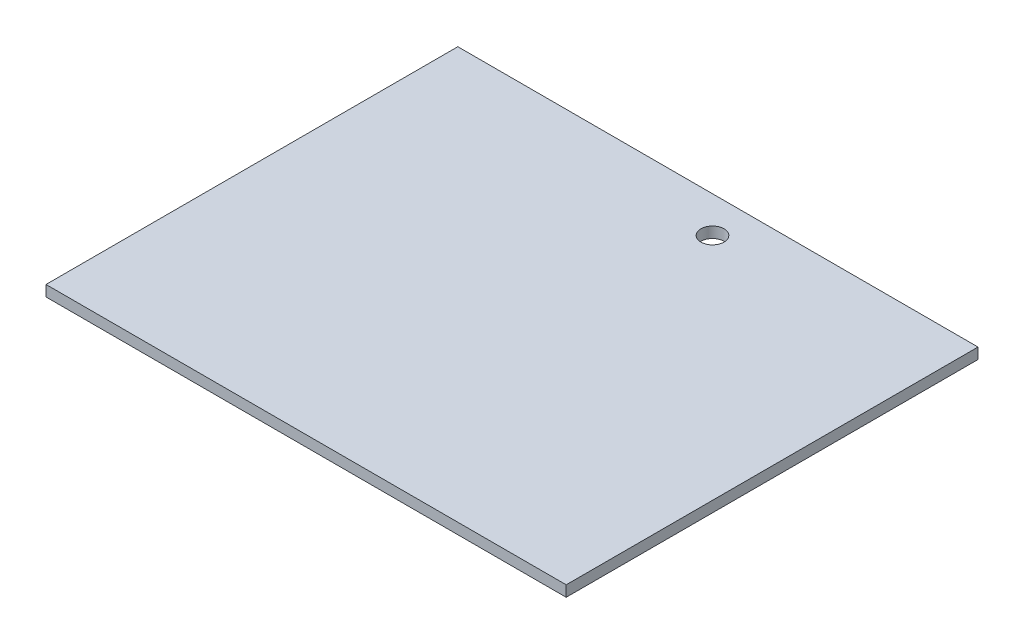
from build123d import *

# Parameters (mm, degrees)
SKETCH1_R           = 1.6
BOSS_EXTRUDE1_DEPTH = 1.5


with BuildPart() as part:
    # Sketch1 → Boss-Extrude1 (new body)
    with BuildSketch(Plane(origin=(0, 0, 0), x_dir=(1, 0, 0), z_dir=(0, 1, 0))):
        Polygon((36, -28.5), (36, 28.5), (4.25, 28.5), (-36, 28.5), (-36, -28.5), align=None)
        with Locations((4.25, 23.5)):
            Circle(SKETCH1_R, mode=Mode.SUBTRACT)
    extrude(amount=BOSS_EXTRUDE1_DEPTH)


solid = part.part
